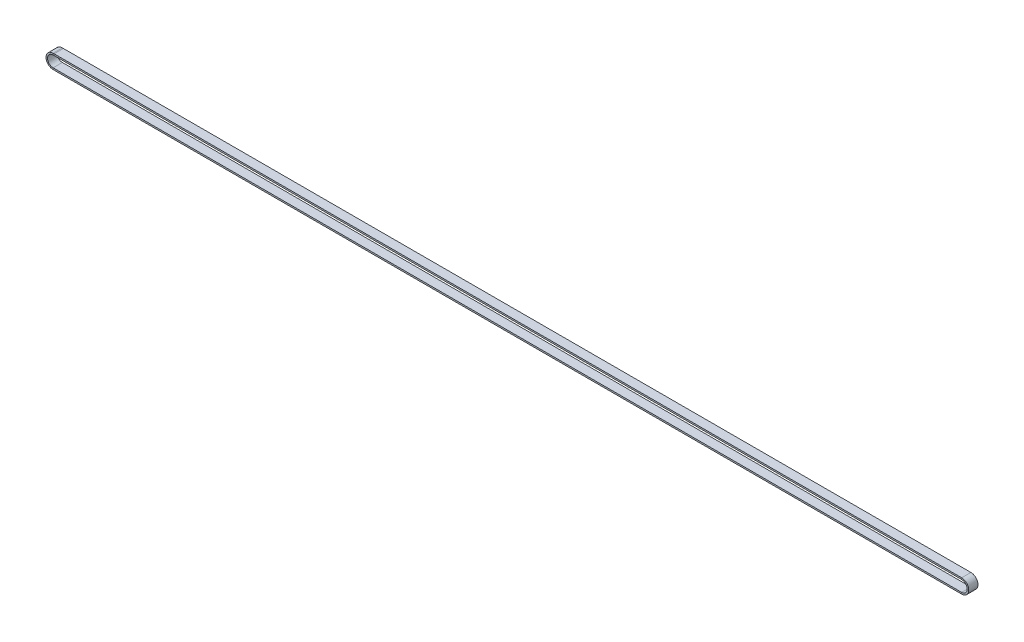
from build123d import *

# Parameters (mm, degrees)
SKETCH3_W = 9
SKETCH3_H = 1.5


with BuildPart() as part:
    # Sweep1: sweep along a path in Sketch2
    with BuildLine(Plane.XY.offset(-90.983366658)) as sweep1_path:
        Line((-1, 41.370834612), (883.520637828, 41.370834612))
        ThreePointArc((883.520637828, 41.370834612), (890.420637828, 34.470834612), (883.520637828, 27.570834612))
        Line((883.520637828, 27.570834612), (-1, 27.570834612))
        ThreePointArc((-1, 27.570834612), (-7.9, 34.470834612), (-1, 41.370834612))
    # Sketch3 → Sweep1 (sweep)
    with BuildSketch(Plane(origin=(0, 0, 0), x_dir=(0, 0, -1), z_dir=(1, 0, 0))):
        with Locations((86.483366658, 40.620834612)):
            Rectangle(SKETCH3_W, SKETCH3_H)
    sweep(path=sweep1_path.line)


solid = part.part
